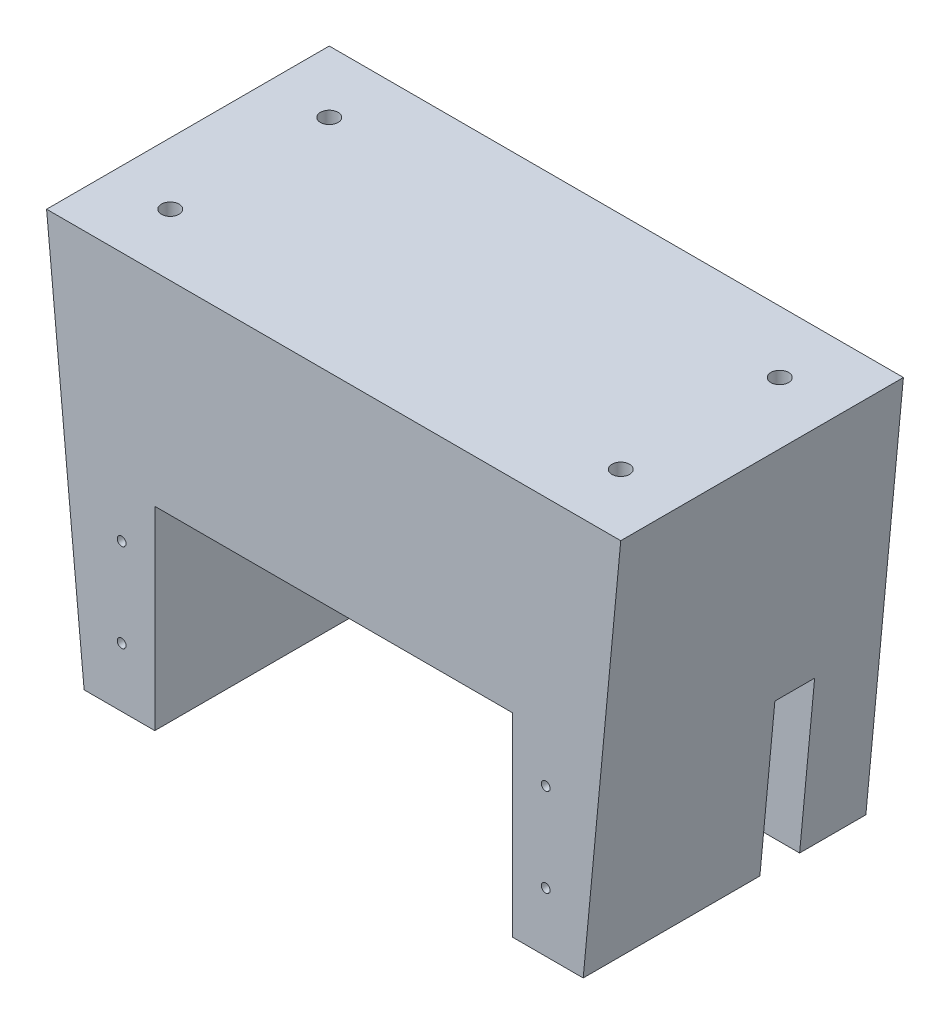
from build123d import *

# Parameters (mm, degrees)
RESSALTO_EXTRUS_O1_DEPTH = 30
ESBO_O3_W                = 4.5
ESBO_O3_H                = 18
CORTE_EXTRUS_O2_DEPTH    = 28.5
RESSALTO_EXTRUS_O2_DEPTH = 2
ESBO_O5_R                = 0.5
CORTE_EXTRUS_O3_DEPTH    = 10
ESBO_O6_R                = 1
CORTE_EXTRUS_O4_DEPTH    = 10


with BuildPart() as part:
    # Esboço1 → Ressalto-extrusão1 (new body)
    with BuildSketch(Plane.XY):
        Polygon((-32.5, 31.319481807), (32.5, 31.319481807), (28.25, -13.680518193), (20.25, -13.680518193), (20.25, 8.319481807), (-20.25, 8.319481807), (-20.25, -13.680518193), (-28.25, -13.680518193), align=None)
    extrude(amount=RESSALTO_EXTRUS_O1_DEPTH)

    # Esboço3 → Corte-extrusão2 (cut)
    with BuildSketch(Plane(origin=(40, 0, 0), x_dir=(0, 0, -1), z_dir=(1, 0, 0))):
        with Locations((-7.75, -4.680518193)):
            Rectangle(ESBO_O3_W, ESBO_O3_H)
    extrude(amount=-CORTE_EXTRUS_O2_DEPTH, mode=Mode.SUBTRACT)

    # Esboço4 → Ressalto-extrusão2 (add)
    with BuildSketch(Plane(origin=(0, 0, 0), x_dir=(-1, 0, 0), z_dir=(0, 0, -1))):
        Polygon((-32.5, 31.319481807), (32.5, 31.319481807), (28.25, -13.680518193), (20.25, -13.680518193), (-20.25, -13.680518193), (-28.25, -13.680518193), align=None)
    extrude(amount=RESSALTO_EXTRUS_O2_DEPTH)

    # Esboço5 → Corte-extrusão3 (cut)
    with BuildSketch(Plane.XY.offset(30)):
        with Locations((-24, 3.019481807)):
            Circle(ESBO_O5_R)
        with Locations((24, 3.019481807)):
            Circle(ESBO_O5_R)
        with Locations((-24, -6.980518193)):
            Circle(ESBO_O5_R)
        with Locations((24, -6.980518193)):
            Circle(ESBO_O5_R)
    extrude(amount=-CORTE_EXTRUS_O3_DEPTH, mode=Mode.SUBTRACT)

    # Esboço6 → Corte-extrusão4 (cut)
    with BuildSketch(Plane(origin=(0, 31.319481807, 0), x_dir=(1, 0, 0), z_dir=(0, 1, 0))):
        with Locations((-25.5, -5)):
            Circle(ESBO_O6_R)
        with Locations((-25.5, -23)):
            Circle(ESBO_O6_R)
        with Locations((25.5, -5)):
            Circle(ESBO_O6_R)
        with Locations((25.5, -23)):
            Circle(ESBO_O6_R)
    extrude(amount=-CORTE_EXTRUS_O4_DEPTH, mode=Mode.SUBTRACT)


solid = part.part
